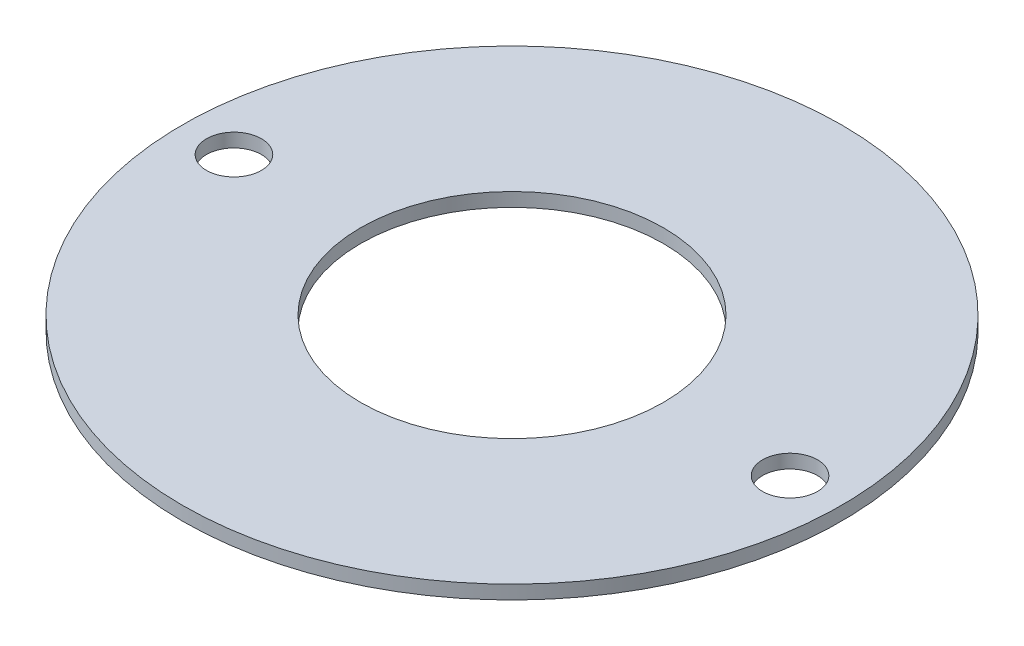
from build123d import *

# Parameters (mm, degrees)
SKETCH1_R           = 76.2
BOSS_EXTRUDE1_DEPTH = 3.175
SKETCH2_R           = 35
CUT_EXTRUDE1_DEPTH  = 3.175
SKETCH3_R           = 6.35
CUT_EXTRUDE2_DEPTH  = 10


with BuildPart() as part:
    # Sketch1 → Boss-Extrude1 (new body)
    with BuildSketch(Plane(origin=(0, 0, 0), x_dir=(1, 0, 0), z_dir=(0, 1, 0))):
        Circle(SKETCH1_R)
    extrude(amount=BOSS_EXTRUDE1_DEPTH)

    # Sketch2 → Cut-Extrude1 (cut)
    with BuildSketch(Plane(origin=(0, 3.175, 0), x_dir=(1, 0, 0), z_dir=(0, 1, 0))):
        Circle(SKETCH2_R)
    extrude(amount=-CUT_EXTRUDE1_DEPTH, mode=Mode.SUBTRACT)

    # Sketch3 → Cut-Extrude2 (cut)
    with BuildSketch(Plane(origin=(0, 3.175, 0), x_dir=(1, 0, 0), z_dir=(0, 1, 0))):
        with Locations((-64.2875, 0)):
            Circle(SKETCH3_R)
        with Locations((64.2875, 0)):
            Circle(SKETCH3_R)
    extrude(amount=-CUT_EXTRUDE2_DEPTH, mode=Mode.SUBTRACT)


solid = part.part
